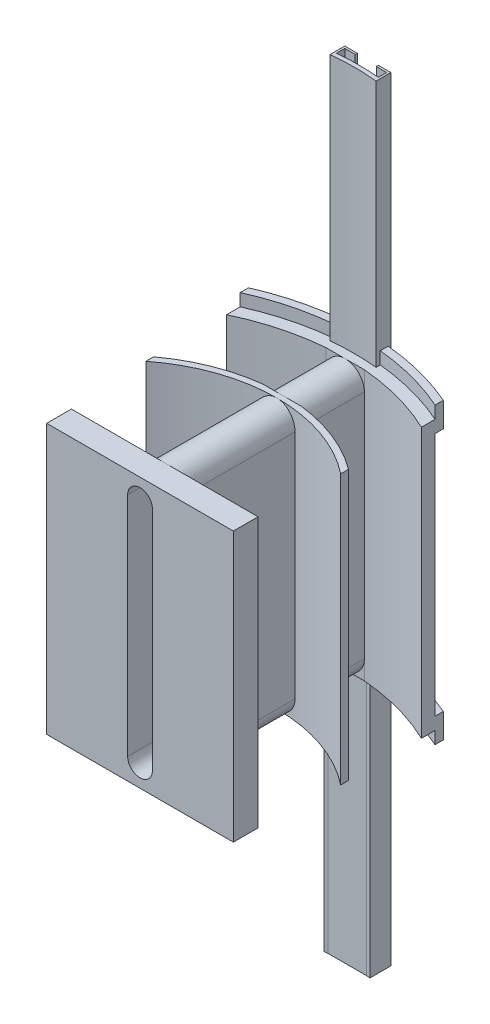
from build123d import *

# Parameters (mm, degrees)
SKETCH1_W                = 45.3
SKETCH1_H                = 65.4
BOSS_EXTRUDE1_DEPTH      = 3
BOSS_EXTRUDE2_DEPTH      = 27.25
BOSS_EXTRUDE3_START      = -32.7
BOSS_EXTRUDE3_DEPTH      = 65.4
CUT_EXTRUDE1_DEPTH       = 65.254280101
CUT_EXTRUDE1_DEPTH_BACK  = 65.254280101
CUT_EXTRUDE3_DEPTH       = 15.325997
BOSS_EXTRUDE4_START      = 6
BOSS_EXTRUDE4_DEPTH      = 6
CUT_EXTRUDE4_DEPTH       = 92.386822264
BOSS_EXTRUDE5_DEPTH      = 92.9
BOSS_EXTRUDE5_DEPTH_BACK = 92.9
BOSS_EXTRUDE6_DEPTH      = 60.2
BOSS_EXTRUDE7_START      = 2
BOSS_EXTRUDE7_DEPTH      = 2
BOSS_EXTRUDE8_START      = -63.2
BOSS_EXTRUDE8_DEPTH      = 123.4


# Read off the part's stored shape, not the designer's step: Boss-Extrude3
with BuildPart() as part:
    # Sketch1 → Boss-Extrude1 (new, symmetric)
    with BuildSketch(Plane.XY):
        Rectangle(SKETCH1_W, SKETCH1_H)
        with BuildLine():
            Line((3, 27.5), (3, -27.5))
            ThreePointArc((3, -27.5), (0, -30.5), (-3, -27.5))
            Line((-3, -27.5), (-3, 27.5))
            ThreePointArc((-3, 27.5), (0, 30.5), (3, 27.5))
        make_face(mode=Mode.SUBTRACT)
    extrude(amount=BOSS_EXTRUDE1_DEPTH, both=True)

    # Sketch3 → Boss-Extrude2 (add)
    with BuildSketch(Plane(origin=(0, 0, -3), x_dir=(-1, 0, 0), z_dir=(0, 0, -1))):
        with BuildLine():
            Line((4.65, 28.050000345), (4.65, -28.050000676))
            ThreePointArc((4.65, -28.050000676), (0, -32.7), (-4.65, -28.050000677))
            Line((-4.65, -28.050000677), (-4.65, 28.050000345))
            ThreePointArc((-4.65, 28.050000345), (0, 32.7), (4.65, 28.050000345))
        make_face()
    extrude(amount=BOSS_EXTRUDE2_DEPTH)

    # Boss-Extrude3 outline → Boss-Extrude3 (add)
    with BuildSketch(Plane(origin=(0, 0, 0), x_dir=(1, 0, 0), z_dir=(0, 1, 0)).offset(BOSS_EXTRUDE3_START)):
        with BuildLine():
            Line((4.65, 31.477081959), (4.65, 46.803079293))
            ThreePointArc((4.65, 46.803079293), (14.382164808, 45.086281989), (23.65, 41.655588809))
            Line((23.65, 41.655588809), (23.65, 44.959205999))
            ThreePointArc((23.65, 44.959205999), (0, 50), (-23.65, 44.959205999))
            Line((-23.65, 44.959205999), (-23.65, 41.655588809))
            ThreePointArc((-23.65, 41.655588809), (-14.382164808, 45.086281989), (-4.65, 46.803079293))
            Line((-4.65, 46.803079293), (-4.65, 31.477081959))
            ThreePointArc((-4.65, 31.477081959), (-14.64207711, 28.955000716), (-23.65, 23.949021894))
            Line((-23.65, 23.949021894), (-23.65, 22.06226871))
            ThreePointArc((-23.65, 22.06226871), (-12.513607029, 28.145153743), (3e-09, 30.25))
            ThreePointArc((3e-09, 30.25), (12.513607029, 28.145153743), (23.65, 22.06226871))
            Line((23.65, 22.06226871), (23.65, 23.949021894))
            ThreePointArc((23.65, 23.949021894), (14.64207711, 28.955000716), (4.65, 31.477081959))
        make_face()
    extrude(amount=BOSS_EXTRUDE3_DEPTH)

    # Sketch5 → Cut-Extrude1 (cut, two sides: drawn at the far end of the back side and taken through both)
    with BuildSketch(Plane.XY.offset(-CUT_EXTRUDE1_DEPTH_BACK)):
        with BuildLine():
            Line((3, -27.5), (3, 27.5))
            ThreePointArc((3, 27.5), (0, 30.5), (-3, 27.5))
            Line((-3, 27.5), (-3, -27.5))
            ThreePointArc((-3, -27.5), (0, -30.5), (3, -27.5))
        make_face()
    extrude(amount=CUT_EXTRUDE1_DEPTH + CUT_EXTRUDE1_DEPTH_BACK, mode=Mode.SUBTRACT)

    # Sketch6 → Cut-Extrude3 (cut)
    with BuildSketch(Plane(origin=(0, 0, -31.477081959), x_dir=(-1, 0, 0), z_dir=(0, 0, -1))):
        with BuildLine():
            ThreePointArc((0, -32.7), (-3.288046293, -31.338046772), (-4.65, -28.050000677))
            Line((-4.65, -28.050000677), (-4.65, -32.7))
            Line((-4.65, -32.7), (0, -32.7))
        make_face()
        with BuildLine():
            ThreePointArc((4.65, -28.050000676), (3.288046294, -31.338046771), (0, -32.7))
            Line((0, -32.7), (4.65, -32.7))
            Line((4.65, -32.7), (4.65, -28.050000676))
        make_face()
        with BuildLine():
            Line((-4.65, 32.7), (-4.65, 28.050000345))
            ThreePointArc((-4.65, 28.050000345), (-3.288046411, 31.338046654), (0, 32.7))
            Line((0, 32.7), (-4.65, 32.7))
        make_face()
        with BuildLine():
            Line((4.65, 32.7), (0, 32.7))
            ThreePointArc((0, 32.7), (3.28804641, 31.338046655), (4.65, 28.050000345))
            Line((4.65, 28.050000345), (4.65, 32.7))
        make_face()
    extrude(amount=CUT_EXTRUDE3_DEPTH, mode=Mode.SUBTRACT)

    # Sketch8 → Boss-Extrude4 (add)
    with BuildSketch(Plane(origin=(0, -29.7, 0), x_dir=(-1, 0, 0), z_dir=(0, -1, 0)).offset(BOSS_EXTRUDE4_START)):
        with BuildLine():
            ThreePointArc((23.65, 44.959205999), (0, 50), (-23.65, 44.959205999))
            Line((-23.65, 44.959205999), (-23.65, 46.959205999))
            ThreePointArc((-23.65, 46.959205999), (0, 51.906346228), (23.65, 46.959205999))
            Line((23.65, 46.959205999), (23.65, 44.959205999))
        make_face()
    boss_extrude4 = extrude(amount=-BOSS_EXTRUDE4_DEPTH)

    # Mirror1: Boss-Extrude4 across plane
    add(boss_extrude4.mirror(Plane.ZX))

    # Sketch10 → Cut-Extrude4 (cut, through all)
    with BuildSketch(Plane(origin=(0, 35.7, 0), x_dir=(1, 0, 0), z_dir=(0, 1, 0))):
        with BuildLine():
            ThreePointArc((0, 51.906346228), (-2.389460165, 51.857943444), (-4.775, 51.712814503))
            Line((-4.775, 51.712814503), (-4.775, 49.803108697))
            ThreePointArc((-4.775, 49.803108697), (-2.389528781, 49.950756269), (0, 50))
            Line((0, 50), (0, 51.906346228))
        make_face()
        with BuildLine():
            ThreePointArc((4.775, 51.712814503), (2.389460165, 51.857943444), (0, 51.906346228))
            Line((0, 51.906346228), (0, 50))
            ThreePointArc((0, 50), (2.389528781, 49.950756269), (4.775, 49.803108697))
            Line((4.775, 49.803108697), (4.775, 51.712814503))
        make_face()
        with BuildLine():
            ThreePointArc((-4.775, 51.712814503), (-4.925016027, 51.700441497), (-5.075, 51.687685822))
            Line((-5.075, 51.687685822), (-5.075, 49.777542134))
            ThreePointArc((-5.075, 49.777542134), (-4.92501659, 49.790520084), (-4.775, 49.803108697))
            Line((-4.775, 49.803108697), (-4.775, 51.712814503))
        make_face()
        with BuildLine():
            ThreePointArc((5.075, 51.687685822), (4.925016027, 51.700441497), (4.775, 51.712814503))
            Line((4.775, 51.712814503), (4.775, 49.803108697))
            ThreePointArc((4.775, 49.803108697), (4.92501659, 49.790520084), (5.075, 49.777542134))
            Line((5.075, 49.777542134), (5.075, 51.687685822))
        make_face()
    extrude(amount=-CUT_EXTRUDE4_DEPTH, mode=Mode.SUBTRACT)

    # Sketch11 → Boss-Extrude5 (add, two sides: drawn at the far end of the back side and taken through both)
    with BuildSketch(Plane(origin=(0, 0, 0), x_dir=(1, 0, 0), z_dir=(0, 1, 0)).offset(-BOSS_EXTRUDE5_DEPTH_BACK)):
        with BuildLine():
            ThreePointArc((-5.575, 49.731441823), (-5.325049888, 49.755033059), (-5.075, 49.777542134))
            Line((-5.075, 49.777542134), (-5.075, 51.787685822))
            Line((-5.075, 51.787685822), (-2.55, 51.787685822))
            Line((-2.55, 51.787685822), (-2.55, 52.287685822))
            Line((-2.55, 52.287685822), (-5.575, 52.287685822))
            Line((-5.575, 52.287685822), (-5.575, 49.731441823))
        make_face()
        with BuildLine():
            ThreePointArc((5.075, 49.777542134), (5.325049888, 49.755033059), (5.575, 49.731441823))
            Line((5.575, 49.731441823), (5.575, 52.287685822))
            Line((5.575, 52.287685822), (2.55, 52.287685822))
            Line((2.55, 52.287685822), (2.55, 51.787685822))
            Line((2.55, 51.787685822), (5.075, 51.787685822))
            Line((5.075, 51.787685822), (5.075, 49.777542134))
        make_face()
    extrude(amount=BOSS_EXTRUDE5_DEPTH + BOSS_EXTRUDE5_DEPTH_BACK)

    # Sketch13 → Boss-Extrude6 (add)
    with BuildSketch(Plane(origin=(0, -92.9, 0), x_dir=(-1, 0, 0), z_dir=(0, -1, 0))):
        with BuildLine():
            ThreePointArc((-5.075, 49.777542134), (-5.325049888, 49.755033059), (-5.575, 49.731441823))
            Line((-5.575, 49.731441823), (-5.575, 47.219284448))
            ThreePointArc((-5.575, 47.219284448), (-5.123234459, 47.263029854), (-4.671126278, 47.303079293))
            Line((-4.671126278, 47.303079293), (0, 47.303079293))
            Line((0, 47.303079293), (4.671126278, 47.303079293))
            ThreePointArc((4.671126278, 47.303079293), (5.123234459, 47.263029854), (5.575, 47.219284448))
            Line((5.575, 47.219284448), (5.575, 49.731441823))
            ThreePointArc((5.575, 49.731441823), (5.325049888, 49.755033059), (5.075, 49.777542134))
            ThreePointArc((5.075, 49.777542134), (0, 50), (-5.075, 49.777542134))
        make_face()
    extrude(amount=-BOSS_EXTRUDE6_DEPTH)

    # Sketch14 → Boss-Extrude7 (add)
    with BuildSketch(Plane(origin=(0, -92.9, 0), x_dir=(-1, 0, 0), z_dir=(0, -1, 0)).offset(BOSS_EXTRUDE7_START)):
        with BuildLine():
            Line((-2.55, 52.287685822), (2.55, 52.287685822))
            Line((2.55, 52.287685822), (5.575, 52.287685822))
            Line((5.575, 52.287685822), (5.575, 47.219284448))
            ThreePointArc((5.575, 47.219284448), (5.123234459, 47.263029854), (4.671126278, 47.303079293))
            Line((4.671126278, 47.303079293), (-4.671126278, 47.303079293))
            ThreePointArc((-4.671126278, 47.303079293), (-5.123234459, 47.263029854), (-5.575, 47.219284448))
            Line((-5.575, 47.219284448), (-5.575, 52.287685822))
            Line((-5.575, 52.287685822), (-2.55, 52.287685822))
        make_face()
    extrude(amount=-BOSS_EXTRUDE7_DEPTH)

    # Sketch15 → Boss-Extrude8 (add)
    with BuildSketch(Plane(origin=(0, 32.7, 0), x_dir=(1, 0, 0), z_dir=(0, 1, 0)).offset(BOSS_EXTRUDE8_START)):
        with BuildLine():
            ThreePointArc((-5.075, 49.777542134), (-5.325049888, 49.755033059), (-5.575, 49.731441823))
            Line((-5.575, 49.731441823), (-5.575, 48.726707775))
            ThreePointArc((-5.575, 48.726707775), (0, 49), (5.575, 48.726707775))
            Line((5.575, 48.726707775), (5.575, 49.731441823))
            ThreePointArc((5.575, 49.731441823), (5.325049888, 49.755033059), (5.075, 49.777542134))
            ThreePointArc((5.075, 49.777542134), (0, 50), (-5.075, 49.777542134))
        make_face()
    boss_extrude8 = extrude(amount=BOSS_EXTRUDE8_DEPTH)

    # Mirror2: Boss-Extrude8 across plane
    add(boss_extrude8.mirror(Plane.ZX))


solid = part.part
